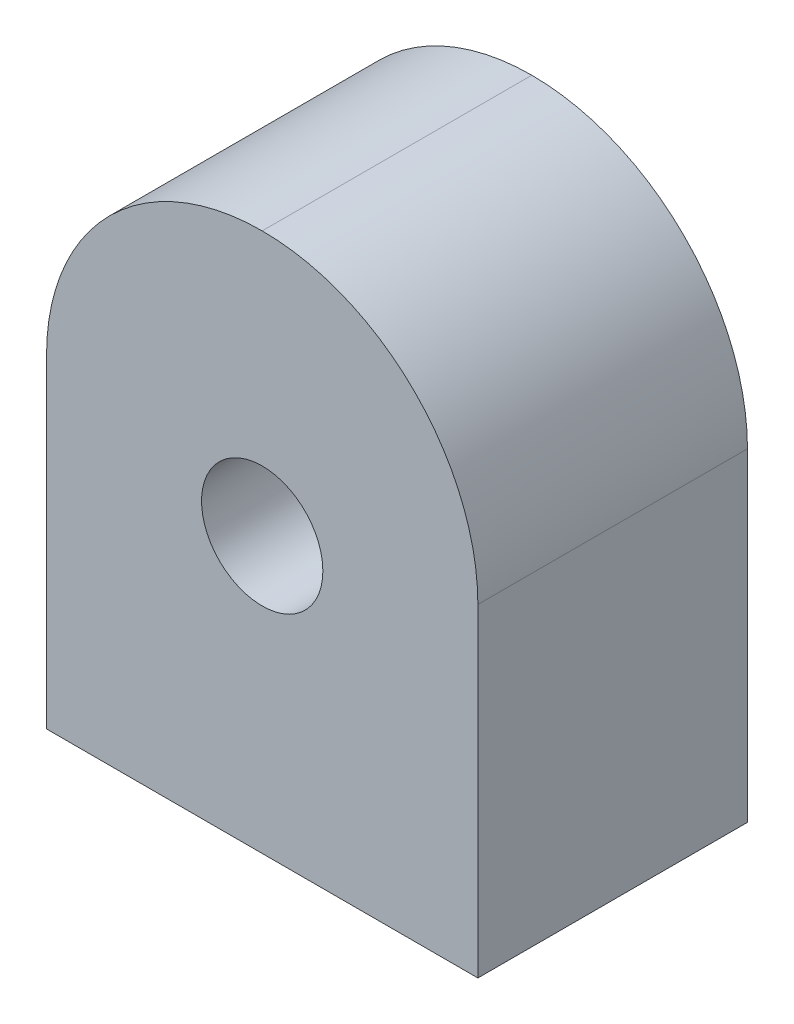
from build123d import *

# Parameters (mm, degrees)
SKETCH1_W           = 16
SKETCH1_H           = 20
BOSS_EXTRUDE1_DEPTH = 10
SKETCH2_R           = 2.25
CUT_EXTRUDE1_DEPTH  = 28.49545417
FILLET1_R           = 8


with BuildPart() as part:
    # Sketch1 → Boss-Extrude1 (new body)
    with BuildSketch(Plane.XY):
        with Locations((8, 10)):
            Rectangle(SKETCH1_W, SKETCH1_H)
    extrude(amount=BOSS_EXTRUDE1_DEPTH)

    # Sketch2 → Cut-Extrude1 (cut, through all)
    with BuildSketch(Plane.XY.offset(10)):
        with Locations((8, 10.2)):
            Circle(SKETCH2_R)
    extrude(amount=-CUT_EXTRUDE1_DEPTH, mode=Mode.SUBTRACT)

    # Fillet1
    fillet1_edges = [part.edges().sort_by_distance(p)[0] for p in [
        (16, 20, 5),
        (0, 20, 5),
    ]]
    fillet(fillet1_edges, radius=FILLET1_R - 0.0001)  # a hair under: the kernel refuses the full size


solid = part.part
